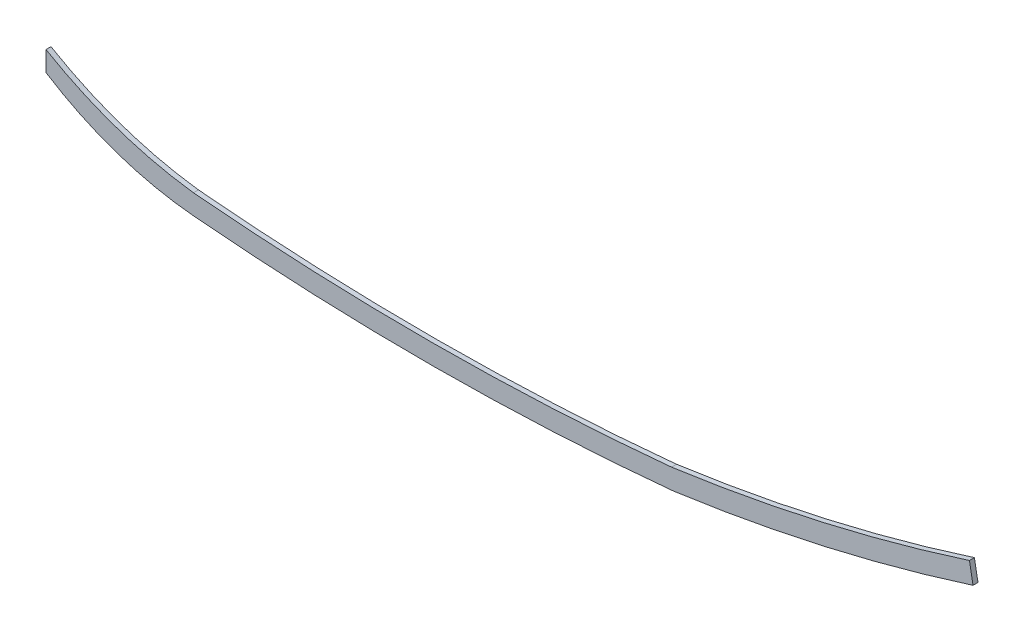
from build123d import *

# Parameters (mm, degrees)
BOSS_EXTRUDE1_DEPTH = 3.175


with BuildPart() as part:
    # Sketch2 → Boss-Extrude1 (new body)
    with BuildSketch(Plane.XY):
        with BuildLine():
            Line((0, -93.726), (0, -81.026))
            ThreePointArc((0, -81.026), (45.355574659, -101.848678739), (93.981781578, -113.082738699))
            ThreePointArc((93.981781578, -113.082738699), (246.372313091, -119.731502068), (398.720709796, -112.17861055))
            ThreePointArc((398.720709796, -112.17861055), (494.586291486, -94.575813677), (588.578984507, -68.77965371))
            Line((588.578984507, -68.77965371), (590.864339182, -81.353629195))
            ThreePointArc((590.864339182, -81.353629195), (496.464017614, -107.144377274), (400.203586987, -124.765753327))
            ThreePointArc((400.203586987, -124.765753327), (247.115945929, -132.400573982), (93.98, -125.805242625))
            ThreePointArc((93.98, -125.805242625), (45.058861036, -115.423125198), (0, -93.726))
        make_face()
    extrude(amount=-BOSS_EXTRUDE1_DEPTH)


solid = part.part
